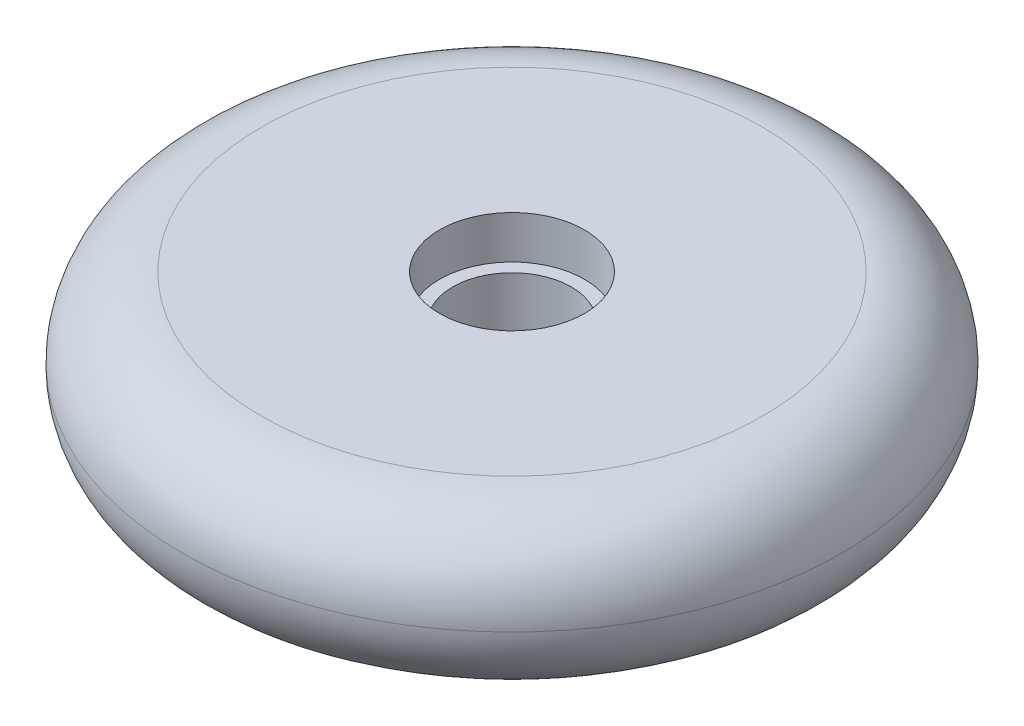
from build123d import *

# Parameters (mm, degrees)
SKETCH1_R           = 50
BOSS_EXTRUDE1_DEPTH = 24
FILLET1_R           = 12
SKETCH2_R           = 11
CUT_EXTRUDE1_DEPTH  = 6.5
CUT_EXTRUDE2_START  = -6.5
SKETCH3_R           = 11
CUT_EXTRUDE2_DEPTH  = 6.5
SKETCH4_R           = 9
CUT_EXTRUDE3_DEPTH  = 73.844011422


with BuildPart() as part:
    # Sketch1 → Boss-Extrude1 (new body)
    with BuildSketch(Plane(origin=(0, 0, 0), x_dir=(1, 0, 0), z_dir=(0, 1, 0))):
        with Locations(Location((0, 0, 0), (0, 0, 270))):
            Circle(SKETCH1_R)
    extrude(amount=BOSS_EXTRUDE1_DEPTH)

    # Fillet1
    fillet1_edges = [part.edges().sort_by_distance(p)[0] for p in [
        (0, 0, -50),
        (0, 24, -50),
    ]]
    fillet(fillet1_edges, radius=FILLET1_R - 0.0001)  # a hair under: the kernel refuses the full size

    # Sketch2 → Cut-Extrude1 (cut)
    with BuildSketch(Plane(origin=(0, 24, 0), x_dir=(1, 0, 0), z_dir=(0, 1, 0))):
        with Locations(Location((0, 0, 0), (0, 0, 270))):
            Circle(SKETCH2_R)
    extrude(amount=-CUT_EXTRUDE1_DEPTH, mode=Mode.SUBTRACT)

    # Sketch3 → Cut-Extrude2 (cut)
    with BuildSketch(Plane.XZ.offset(CUT_EXTRUDE2_START)):
        with Locations(Location((0, 0, 0), (0, 0, 90))):
            Circle(SKETCH3_R)
    extrude(amount=CUT_EXTRUDE2_DEPTH, mode=Mode.SUBTRACT)

    # Sketch4 → Cut-Extrude3 (cut, through all)
    with BuildSketch(Plane.XZ.offset(-6.5)):
        with Locations(Location((0, 0, 0), (0, 0, 270))):
            Circle(SKETCH4_R)
    extrude(amount=-CUT_EXTRUDE3_DEPTH, mode=Mode.SUBTRACT)


solid = part.part
